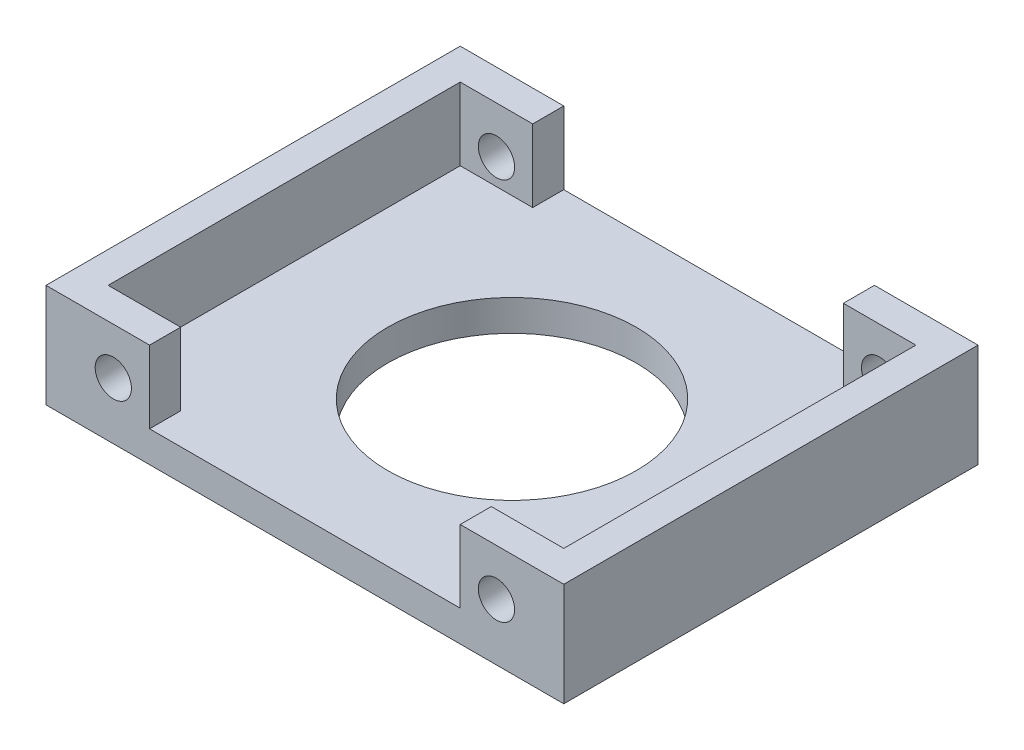
from build123d import *

# Parameters (mm, degrees)
SKETCH1_W           = 50
SKETCH1_H           = 40
BOSS_EXTRUDE1_DEPTH = 3
SKETCH2_R           = 12
CUT_EXTRUDE1_DEPTH  = 33.155870382
SKETCH3_W           = 3
SKETCH3_H           = 40
BOSS_EXTRUDE2_DEPTH = 7
SKETCH4_W           = 7
SKETCH4_H           = 7
BOSS_EXTRUDE3_DEPTH = 3
SKETCH5_R           = 1.75
CUT_EXTRUDE2_DEPTH  = 49.218253805


with BuildPart() as part:
    # Sketch1 → Boss-Extrude1 (new body)
    with BuildSketch(Plane(origin=(0, 0, 0), x_dir=(1, 0, 0), z_dir=(0, 1, 0))):
        Rectangle(SKETCH1_W, SKETCH1_H)
    extrude(amount=BOSS_EXTRUDE1_DEPTH)

    # Sketch2 → Cut-Extrude1 (cut, through all)
    with BuildSketch(Plane(origin=(0, 3, 0), x_dir=(1, 0, 0), z_dir=(0, 1, 0))):
        Circle(SKETCH2_R)
    extrude(amount=-CUT_EXTRUDE1_DEPTH, mode=Mode.SUBTRACT)

    # Sketch3 → Boss-Extrude2 (add)
    with BuildSketch(Plane(origin=(0, 3, 0), x_dir=(1, 0, 0), z_dir=(0, 1, 0))):
        with Locations((-23.5, 0)):
            Rectangle(SKETCH3_W, SKETCH3_H)
        with Locations((23.5, 0)):
            Rectangle(SKETCH3_W, SKETCH3_H)
    extrude(amount=BOSS_EXTRUDE2_DEPTH)

    # Sketch4 → Boss-Extrude3 (add)
    with BuildSketch(Plane.XY.offset(20)):
        with Locations((-18.5, 6.5)):
            Rectangle(SKETCH4_W, SKETCH4_H)
        with Locations((18.5, 6.5)):
            Rectangle(SKETCH4_W, SKETCH4_H)
    boss_extrude3 = extrude(amount=-BOSS_EXTRUDE3_DEPTH)

    # Sketch5 → Cut-Extrude2 (cut, through all)
    with BuildSketch(Plane.XY.offset(20)):
        with Locations((-18.5, 5.5)):
            Circle(SKETCH5_R)
        with Locations((18.5, 5.5)):
            Circle(SKETCH5_R)
    cut_extrude2 = extrude(amount=-CUT_EXTRUDE2_DEPTH, mode=Mode.SUBTRACT)

    # Mirror1: Boss-Extrude3, Cut-Extrude2 across plane
    add(boss_extrude3.mirror(Plane.XY))
    add(cut_extrude2.mirror(Plane.XY), mode=Mode.SUBTRACT)


solid = part.part
